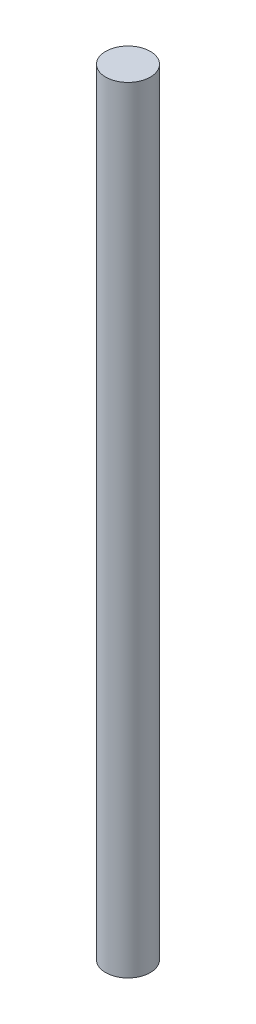
from build123d import *

# Parameters (mm, degrees)
SKETCH1_R           = 9.4996
BOSS_EXTRUDE1_DEPTH = 165.1


with BuildPart() as part:
    # Sketch1 → Boss-Extrude1 (new, symmetric)
    with BuildSketch(Plane(origin=(0, 0, 0), x_dir=(1, 0, 0), z_dir=(0, 1, 0))):
        Circle(SKETCH1_R)
    extrude(amount=BOSS_EXTRUDE1_DEPTH, both=True)


solid = part.part
